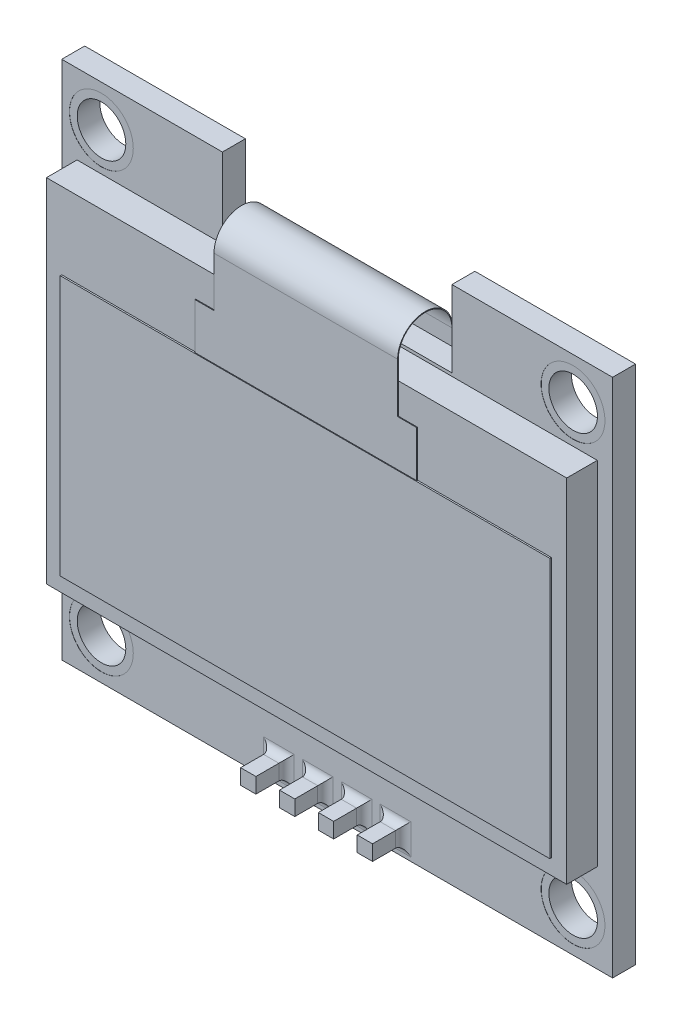
from build123d import *

# Parameters (mm, degrees)
CROQUIS1_W                   = 36
CROQUIS1_H                   = 34
SALIENTE_EXTRUIR1_DEPTH      = 1.5
CROQUIS2_W                   = 15
CROQUIS2_H                   = 5
CORTAR_EXTRUIR1_DEPTH        = 1.5
CROQUIS3_R                   = 1.5875
CORTAR_EXTRUIR2_DEPTH        = 2.54
CROQUIS4_W                   = 34
CROQUIS4_H                   = 23
SALIENTE_EXTRUIR2_DEPTH      = 2
SALIENTE_EXTRUIR3_DEPTH      = 0.05
CROQUIS5_W                   = 32
CROQUIS5_H                   = 17
SALIENTE_EXTRUIR5_DEPTH      = 0.1
SALIENTE_EXTRUIR6_DEPTH      = 0.05
CROQUIS12_W                  = 12
CROQUIS12_H                  = 0.05
SALIENTE_EXTRUIR7_DEPTH      = 2
SALIENTE_EXTRUIR7_DEPTH_BACK = 10
CROQUIS15_W                  = 1
CROQUIS15_H                  = 1
CROQUIS16_W                  = 2
CROQUIS16_H                  = 2
SALIENTE_EXTRUIR8_DEPTH      = 2
CROQUIS17_W                  = 9.62
CROQUIS17_H                  = 1.5
SALIENTE_EXTRUIR9_DEPTH      = 2
REDONDEO1_R                  = 0.5
CROQUIS18_W                  = 0.1
CROQUIS18_H                  = 2
SALIENTE_EXTRUIR10_DEPTH     = 0.1
CROQUIS19_W                  = 0.8
CROQUIS19_H                  = 2
SALIENTE_EXTRUIR11_DEPTH     = 1
MATRIZL1_COUNT               = 11
MATRIZL1_PITCH               = 2.8
CROQUIS22_W                  = 2
CROQUIS22_H                  = 0.8
CROQUIS22_W_2                = 1.5
CROQUIS22_H_2                = 3
SALIENTE_EXTRUIR12_DEPTH     = 1
CROQUIS40_W                  = 0.949222494
CROQUIS40_H                  = 0.489139996
CROQUIS40_W_2                = 1.06366802
CROQUIS40_H_2                = 0.489139997
SALIENTE_EXTRUIR13_DEPTH     = 0.5
REDONDEO3_R                  = 1
CROQUIS41_R                  = 2.0875
CORTAR_EXTRUIR4_DEPTH        = 0.01
CORTAR_EXTRUIR5_START        = -0.01
CROQUIS42_R                  = 2.0875
CORTAR_EXTRUIR5_DEPTH        = 0.01


with BuildPart() as part:
    # Croquis1 → Saliente-Extruir1 (new body)
    with BuildSketch(Plane.XY):
        Rectangle(CROQUIS1_W, CROQUIS1_H)
    extrude(amount=SALIENTE_EXTRUIR1_DEPTH)

    # Croquis2 → Cortar-Extruir1 (cut)
    with BuildSketch(Plane.XY.offset(1.5)):
        with Locations((0, 14.5)):
            Rectangle(CROQUIS2_W, CROQUIS2_H)
    extrude(amount=-CORTAR_EXTRUIR1_DEPTH, mode=Mode.SUBTRACT)

    # Croquis3 → Cortar-Extruir2 (cut)
    with BuildSketch(Plane.XY.offset(1.5)):
        with Locations((-15.4125, 14.2875)):
            Circle(CROQUIS3_R)
        with Locations((15.4125, 14.2875)):
            Circle(CROQUIS3_R)
        with Locations((15.4125, -14.2875)):
            Circle(CROQUIS3_R)
        with Locations((-15.4125, -14.2875)):
            Circle(CROQUIS3_R)
    extrude(amount=-CORTAR_EXTRUIR2_DEPTH, mode=Mode.SUBTRACT)

    # Croquis4 → Saliente-Extruir2 (add)
    with BuildSketch(Plane.XY.offset(1.5)):
        with Locations((0, 0.3)):
            Rectangle(CROQUIS4_W, CROQUIS4_H)
    extrude(amount=SALIENTE_EXTRUIR2_DEPTH)

    # Croquis7 → Saliente-Extruir3 (add)
    with BuildSketch(Plane(origin=(0, 0, 0), x_dir=(-1, 0, 0), z_dir=(0, 0, -1))):
        Polygon((-11, 6), (11, 6), (11, 9), (6, 12.5), (6, 13), (-6, 13), (-6, 12.5), (-11, 9), align=None)
    extrude(amount=SALIENTE_EXTRUIR3_DEPTH)

    # Croquis5 → Saliente-Extruir5 (add)
    with BuildSketch(Plane.XY.offset(3.5)):
        with Locations((0, -1.7)):
            Rectangle(CROQUIS5_W, CROQUIS5_H)
    extrude(amount=SALIENTE_EXTRUIR5_DEPTH)

    # Croquis14 → Saliente-Extruir6 (add)
    with BuildSketch(Plane.XY.offset(3.5)):
        Polygon((-6, 11.8), (6, 11.8), (6, 9.8), (7.248091461, 9.8), (7.248091461, 3.8), (-7.248091461, 3.8), (-7.248091461, 9.8), (-6, 9.8), align=None)
    extrude(amount=SALIENTE_EXTRUIR6_DEPTH)

    # Barrer3: sweep along a path in Croquis8
    with BuildLine(Plane(origin=(0, 0, 0), x_dir=(0, 0, -1), z_dir=(1, 0, 0))) as barrer3_path:
        Line((0.025, 13), (0.025, 13.047852621))
        ThreePointArc((0.025, 13.047852621), (-1.75, 14.822852621), (-3.525, 13.047852621))
        Line((-3.525, 13.047852621), (-3.525, 11.8))
    # Croquis12 → Barrer3 (sweep)
    with BuildSketch(Plane(origin=(0, 13, 0), x_dir=(1, 0, 0), z_dir=(0, 1, 0))):
        with Locations((0, 0.025)):
            Rectangle(CROQUIS12_W, CROQUIS12_H)
    sweep(path=barrer3_path.line)

    # Croquis15 → Saliente-Extruir7 (add, two sides: drawn at the far end of the back side and taken through both)
    with BuildSketch(Plane.XY.offset(1.5).offset(-SALIENTE_EXTRUIR7_DEPTH_BACK)):
        with Locations((1.27, -15.75)):
            Rectangle(CROQUIS15_W, CROQUIS15_H)
        with Locations((3.81, -15.75)):
            Rectangle(CROQUIS15_W, CROQUIS15_H)
        with Locations((-1.27, -15.75)):
            Rectangle(CROQUIS15_W, CROQUIS15_H)
        with Locations((-3.81, -15.75)):
            Rectangle(CROQUIS15_W, CROQUIS15_H)
    extrude(amount=SALIENTE_EXTRUIR7_DEPTH + SALIENTE_EXTRUIR7_DEPTH_BACK)

    # Croquis16 → Saliente-Extruir8 (add)
    with BuildSketch(Plane(origin=(0, 0, 0), x_dir=(-1, 0, 0), z_dir=(0, 0, -1))):
        with Locations((3.81, -15.75)):
            Rectangle(CROQUIS16_W, CROQUIS16_H)
        with Locations((1.27, -15.75)):
            Rectangle(CROQUIS16_W, CROQUIS16_H)
        with Locations((-1.27, -15.75)):
            Rectangle(CROQUIS16_W, CROQUIS16_H)
        with Locations((-3.81, -15.75)):
            Rectangle(CROQUIS16_W, CROQUIS16_H)
    extrude(amount=SALIENTE_EXTRUIR8_DEPTH)

    # Croquis17 → Saliente-Extruir9 (add)
    with BuildSketch(Plane(origin=(0, 0, 0), x_dir=(-1, 0, 0), z_dir=(0, 0, -1))):
        with Locations((0, -15.75)):
            Rectangle(CROQUIS17_W, CROQUIS17_H)
    extrude(amount=SALIENTE_EXTRUIR9_DEPTH)

    # Redondeo1
    redondeo1_edges = [part.edges().sort_by_distance(p)[0] for p in [
        (3.81, -16.25, 1.5),
        (4.31, -15.75, 1.5),
        (3.81, -15.25, 1.5),
        (3.31, -15.75, 1.5),
        (1.27, -16.25, 1.5),
        (1.77, -15.75, 1.5),
        (1.27, -15.25, 1.5),
        (0.77, -15.75, 1.5),
        (-1.27, -16.25, 1.5),
        (-0.77, -15.75, 1.5),
        (-1.27, -15.25, 1.5),
        (-1.77, -15.75, 1.5),
        (-3.81, -16.25, 1.5),
        (-3.31, -15.75, 1.5),
        (-3.81, -15.25, 1.5),
        (-4.31, -15.75, 1.5),
    ]]
    fillet(redondeo1_edges, radius=REDONDEO1_R)

    # Croquis18 → Saliente-Extruir10 (add)
    with BuildSketch(Plane(origin=(0, 0, 0), x_dir=(-1, 0, 0), z_dir=(0, 0, -1))):
        with Locations((-10.677251375, 5.762476183)):
            Rectangle(CROQUIS18_W, CROQUIS18_H)
        with Locations((-10.377251375, 5.762476183)):
            Rectangle(CROQUIS18_W, CROQUIS18_H)
        with Locations((-10.077251375, 5.762476183)):
            Rectangle(CROQUIS18_W, CROQUIS18_H)
        with Locations((-9.777251375, 5.762476183)):
            Rectangle(CROQUIS18_W, CROQUIS18_H)
        with Locations((-9.477251375, 5.762476183)):
            Rectangle(CROQUIS18_W, CROQUIS18_H)
        with Locations((-9.177251375, 5.762476183)):
            Rectangle(CROQUIS18_W, CROQUIS18_H)
        with Locations((-8.877251375, 5.762476183)):
            Rectangle(CROQUIS18_W, CROQUIS18_H)
        with Locations((-8.577251375, 5.762476183)):
            Rectangle(CROQUIS18_W, CROQUIS18_H)
        with Locations((-8.277251375, 5.762476183)):
            Rectangle(CROQUIS18_W, CROQUIS18_H)
        with Locations((-7.977251375, 5.762476183)):
            Rectangle(CROQUIS18_W, CROQUIS18_H)
        with Locations((-7.677251375, 5.762476183)):
            Rectangle(CROQUIS18_W, CROQUIS18_H)
        with Locations((-7.377251375, 5.762476183)):
            Rectangle(CROQUIS18_W, CROQUIS18_H)
        with Locations((-7.077251375, 5.762476183)):
            Rectangle(CROQUIS18_W, CROQUIS18_H)
        with Locations((-6.777251375, 5.762476183)):
            Rectangle(CROQUIS18_W, CROQUIS18_H)
        with Locations((-6.477251375, 5.762476183)):
            Rectangle(CROQUIS18_W, CROQUIS18_H)
        with Locations((-6.177251375, 5.762476183)):
            Rectangle(CROQUIS18_W, CROQUIS18_H)
        with Locations((-5.877251375, 5.762476183)):
            Rectangle(CROQUIS18_W, CROQUIS18_H)
        with Locations((-5.577251375, 5.762476183)):
            Rectangle(CROQUIS18_W, CROQUIS18_H)
        with Locations((-5.277251375, 5.762476183)):
            Rectangle(CROQUIS18_W, CROQUIS18_H)
        with Locations((-4.977251375, 5.762476183)):
            Rectangle(CROQUIS18_W, CROQUIS18_H)
        with Locations((-4.677251375, 5.762476183)):
            Rectangle(CROQUIS18_W, CROQUIS18_H)
        with Locations((-4.377251375, 5.762476183)):
            Rectangle(CROQUIS18_W, CROQUIS18_H)
        with Locations((-4.077251375, 5.762476183)):
            Rectangle(CROQUIS18_W, CROQUIS18_H)
        with Locations((-3.777251375, 5.762476183)):
            Rectangle(CROQUIS18_W, CROQUIS18_H)
        with Locations((-3.477251375, 5.762476183)):
            Rectangle(CROQUIS18_W, CROQUIS18_H)
        with Locations((-3.177251375, 5.762476183)):
            Rectangle(CROQUIS18_W, CROQUIS18_H)
        with Locations((-2.877251375, 5.762476183)):
            Rectangle(CROQUIS18_W, CROQUIS18_H)
        with Locations((-2.577251375, 5.762476183)):
            Rectangle(CROQUIS18_W, CROQUIS18_H)
        with Locations((-2.277251375, 5.762476183)):
            Rectangle(CROQUIS18_W, CROQUIS18_H)
        with Locations((-1.977251375, 5.762476183)):
            Rectangle(CROQUIS18_W, CROQUIS18_H)
        with Locations((-1.677251375, 5.762476183)):
            Rectangle(CROQUIS18_W, CROQUIS18_H)
        with Locations((-1.377251375, 5.762476183)):
            Rectangle(CROQUIS18_W, CROQUIS18_H)
        with Locations((-1.077251375, 5.762476183)):
            Rectangle(CROQUIS18_W, CROQUIS18_H)
        with Locations((-0.777251375, 5.762476183)):
            Rectangle(CROQUIS18_W, CROQUIS18_H)
        with Locations((-0.477251375, 5.762476183)):
            Rectangle(CROQUIS18_W, CROQUIS18_H)
        with Locations((-0.177251375, 5.762476183)):
            Rectangle(CROQUIS18_W, CROQUIS18_H)
        with Locations((0.122748625, 5.762476183)):
            Rectangle(CROQUIS18_W, CROQUIS18_H)
        with Locations((0.422748625, 5.762476183)):
            Rectangle(CROQUIS18_W, CROQUIS18_H)
        with Locations((0.722748625, 5.762476183)):
            Rectangle(CROQUIS18_W, CROQUIS18_H)
        with Locations((1.022748625, 5.762476183)):
            Rectangle(CROQUIS18_W, CROQUIS18_H)
        with Locations((1.322748625, 5.762476183)):
            Rectangle(CROQUIS18_W, CROQUIS18_H)
        with Locations((1.622748625, 5.762476183)):
            Rectangle(CROQUIS18_W, CROQUIS18_H)
        with Locations((1.922748625, 5.762476183)):
            Rectangle(CROQUIS18_W, CROQUIS18_H)
        with Locations((2.222748625, 5.762476183)):
            Rectangle(CROQUIS18_W, CROQUIS18_H)
        with Locations((2.522748625, 5.762476183)):
            Rectangle(CROQUIS18_W, CROQUIS18_H)
        with Locations((2.822748625, 5.762476183)):
            Rectangle(CROQUIS18_W, CROQUIS18_H)
        with Locations((3.122748625, 5.762476183)):
            Rectangle(CROQUIS18_W, CROQUIS18_H)
        with Locations((3.422748625, 5.762476183)):
            Rectangle(CROQUIS18_W, CROQUIS18_H)
        with Locations((3.722748625, 5.762476183)):
            Rectangle(CROQUIS18_W, CROQUIS18_H)
        with Locations((4.022748625, 5.762476183)):
            Rectangle(CROQUIS18_W, CROQUIS18_H)
        with Locations((4.322748625, 5.762476183)):
            Rectangle(CROQUIS18_W, CROQUIS18_H)
        with Locations((4.622748625, 5.762476183)):
            Rectangle(CROQUIS18_W, CROQUIS18_H)
        with Locations((4.922748625, 5.762476183)):
            Rectangle(CROQUIS18_W, CROQUIS18_H)
        with Locations((5.222748625, 5.762476183)):
            Rectangle(CROQUIS18_W, CROQUIS18_H)
        with Locations((5.522748625, 5.762476183)):
            Rectangle(CROQUIS18_W, CROQUIS18_H)
        with Locations((5.822748625, 5.762476183)):
            Rectangle(CROQUIS18_W, CROQUIS18_H)
        with Locations((6.122748625, 5.762476183)):
            Rectangle(CROQUIS18_W, CROQUIS18_H)
        with Locations((6.422748625, 5.762476183)):
            Rectangle(CROQUIS18_W, CROQUIS18_H)
        with Locations((6.722748625, 5.762476183)):
            Rectangle(CROQUIS18_W, CROQUIS18_H)
        with Locations((7.022748625, 5.762476183)):
            Rectangle(CROQUIS18_W, CROQUIS18_H)
        with Locations((7.322748625, 5.762476183)):
            Rectangle(CROQUIS18_W, CROQUIS18_H)
        with Locations((7.622748625, 5.762476183)):
            Rectangle(CROQUIS18_W, CROQUIS18_H)
        with Locations((7.922748625, 5.762476183)):
            Rectangle(CROQUIS18_W, CROQUIS18_H)
        with Locations((8.222748625, 5.762476183)):
            Rectangle(CROQUIS18_W, CROQUIS18_H)
        with Locations((8.522748625, 5.762476183)):
            Rectangle(CROQUIS18_W, CROQUIS18_H)
        with Locations((8.822748625, 5.762476183)):
            Rectangle(CROQUIS18_W, CROQUIS18_H)
        with Locations((9.122748625, 5.762476183)):
            Rectangle(CROQUIS18_W, CROQUIS18_H)
        with Locations((9.422748625, 5.762476183)):
            Rectangle(CROQUIS18_W, CROQUIS18_H)
        with Locations((9.722748625, 5.762476183)):
            Rectangle(CROQUIS18_W, CROQUIS18_H)
        with Locations((10.022748625, 5.762476183)):
            Rectangle(CROQUIS18_W, CROQUIS18_H)
        with Locations((10.322748625, 5.762476183)):
            Rectangle(CROQUIS18_W, CROQUIS18_H)
        with Locations((10.622748625, 5.762476183)):
            Rectangle(CROQUIS18_W, CROQUIS18_H)
    extrude(amount=SALIENTE_EXTRUIR10_DEPTH)

    # Croquis19 → Saliente-Extruir11 (add)
    with BuildSketch(Plane(origin=(0, 0, 0), x_dir=(-1, 0, 0), z_dir=(0, 0, -1))):
        with Locations((-12.6, 0)):
            Rectangle(CROQUIS19_W, CROQUIS19_H)
    saliente_extruir11 = extrude(amount=SALIENTE_EXTRUIR11_DEPTH)

    # Croquis20 → Revolución1 (revolve)
    with BuildSketch(Plane.XZ.offset(1)):
        with BuildLine():
            Line((12.6, -0.359578875), (12.6, 0.359578875))
            ThreePointArc((12.6, 0.359578875), (12.240421125, 0), (12.6, -0.359578875))
        make_face()
    revoluci_n1 = revolve(axis=Axis((12.6, -1, -0.359578875), (0, 0, 1)))

    # Croquis21 → Revolución2 (revolve)
    with BuildSketch(Plane(origin=(0, 1, 0), x_dir=(1, 0, 0), z_dir=(0, 1, 0))):
        with BuildLine():
            Line((12.6, 0.367959973), (12.6, -0.367959973))
            ThreePointArc((12.6, -0.367959973), (12.967959973, 0), (12.6, 0.367959973))
        make_face()
    revoluci_n2 = revolve(axis=Axis((12.6, 1, -0.367959973), (0, 0, 1)))

    # MatrizL1: Saliente-Extruir11, Revolución1, Revolución2 ×11
    with Locations(*[(-i * MATRIZL1_PITCH, 0, 0) for i in range(1, MATRIZL1_COUNT)]):
        add(saliente_extruir11)
        add(revoluci_n1)
        add(revoluci_n2)

    # Croquis22 → Saliente-Extruir12 (add)
    with BuildSketch(Plane(origin=(0, 0, 0), x_dir=(-1, 0, 0), z_dir=(0, 0, -1))):
        with Locations((-7, -5.686157652)):
            Rectangle(CROQUIS22_W, CROQUIS22_H)
        with Locations((-7, -7.986157652)):
            Rectangle(CROQUIS22_W, CROQUIS22_H)
        with Locations((-12.6, -6.836157652)):
            Rectangle(CROQUIS22_W_2, CROQUIS22_H_2)
        with Locations((7, -7.986157652)):
            Rectangle(CROQUIS22_W, CROQUIS22_H)
        with Locations((7, -5.686157652)):
            Rectangle(CROQUIS22_W, CROQUIS22_H)
        with Locations((-13.360034797, -10.01424112)):
            Rectangle(CROQUIS22_W, CROQUIS22_H)
        with Locations((-1.25247771, -12.9424589)):
            Rectangle(CROQUIS22_W, CROQUIS22_H)
        with Locations((1.25247771, -11.666949526)):
            Rectangle(CROQUIS22_W, CROQUIS22_H)
    extrude(amount=SALIENTE_EXTRUIR12_DEPTH)

    # Croquis26 → Revolución4 (revolve)
    with BuildSketch(Plane.ZY.offset(8)):
        with BuildLine():
            Line((0.371566211, -7.986157652), (-0.371566211, -7.986157652))
            ThreePointArc((-0.371566211, -7.986157652), (0, -7.614591441), (0.371566211, -7.986157652))
        make_face()
    revolve(axis=Axis((-8, -7.986157652, 0.371566211), (0, 0, -1)))

    # Croquis27 → Revolución5 (revolve)
    with BuildSketch(Plane.ZY.offset(8)):
        with BuildLine():
            Line((-0.362080918, -5.686157652), (0.362080918, -5.686157652))
            ThreePointArc((0.362080918, -5.686157652), (0, -5.324076734), (-0.362080918, -5.686157652))
        make_face()
    revolve(axis=Axis((-8, -5.686157652, -0.362080918), (0, 0, 1)))

    # Croquis28 → Revolución6 (revolve)
    with BuildSketch(Plane(origin=(-6, 0, 0), x_dir=(0, 0, -1), z_dir=(1, 0, 0))):
        with BuildLine():
            Line((0.361147888, -5.686157652), (-0.361147888, -5.686157652))
            ThreePointArc((-0.361147888, -5.686157652), (0, -6.04730554), (0.361147888, -5.686157652))
        make_face()
    revolve(axis=Axis((-6, -5.686157652, -0.361147888), (0, 0, 1)))

    # Croquis29 → Revolución7 (revolve)
    with BuildSketch(Plane(origin=(-6, 0, 0), x_dir=(0, 0, -1), z_dir=(1, 0, 0))):
        with BuildLine():
            Line((0.358539057, -7.986157652), (-0.358539057, -7.986157652))
            ThreePointArc((-0.358539057, -7.986157652), (0, -8.344696709), (0.358539057, -7.986157652))
        make_face()
    revolve(axis=Axis((-6, -7.986157652, -0.358539057), (0, 0, 1)))

    # Croquis30 → Revolución8 (revolve)
    with BuildSketch(Plane(origin=(8, 0, 0), x_dir=(0, 0, -1), z_dir=(1, 0, 0))):
        with BuildLine():
            Line((0.347340626, -5.686157652), (-0.347340626, -5.686157652))
            ThreePointArc((-0.347340626, -5.686157652), (0, -6.033498278), (0.347340626, -5.686157652))
        make_face()
    revolve(axis=Axis((8, -5.686157652, -0.347340626), (0, 0, 1)))

    # Croquis31 → Revolución9 (revolve)
    with BuildSketch(Plane(origin=(8, 0, 0), x_dir=(0, 0, -1), z_dir=(1, 0, 0))):
        with BuildLine():
            Line((0.349039637, -7.986157652), (-0.349039637, -7.986157652))
            ThreePointArc((-0.349039637, -7.986157652), (0, -8.335197289), (0.349039637, -7.986157652))
        make_face()
    revolve(axis=Axis((8, -7.986157652, -0.349039637), (0, 0, 1)))

    # Croquis32 → Revolución10 (revolve)
    with BuildSketch(Plane.ZY.offset(-6)):
        with BuildLine():
            Line((0.330676326, -7.986157652), (-0.330676326, -7.986157652))
            ThreePointArc((-0.330676326, -7.986157652), (0, -7.655481326), (0.330676326, -7.986157652))
        make_face()
    revolve(axis=Axis((6, -7.986157652, 0.330676326), (0, 0, -1)))

    # Croquis33 → Revolución11 (revolve)
    with BuildSketch(Plane.ZY.offset(-6)):
        with BuildLine():
            Line((0.332465018, -5.686157652), (-0.332465018, -5.686157652))
            ThreePointArc((-0.332465018, -5.686157652), (0, -5.353692634), (0.332465018, -5.686157652))
        make_face()
    revolve(axis=Axis((6, -5.686157652, 0.332465018), (0, 0, -1)))

    # Croquis34 → Revolución12 (revolve)
    with BuildSketch(Plane.ZY.offset(-12.360034797)):
        with BuildLine():
            Line((0.335465257, -10.01424112), (-0.335465257, -10.01424112))
            ThreePointArc((-0.335465257, -10.01424112), (0, -9.678775864), (0.335465257, -10.01424112))
        make_face()
    revolve(axis=Axis((12.360034797, -10.01424112, 0.335465257), (0, 0, -1)))

    # Croquis35 → Revolución13 (revolve)
    with BuildSketch(Plane(origin=(14.360034797, 0, 0), x_dir=(0, 0, -1), z_dir=(1, 0, 0))):
        with BuildLine():
            Line((0.348274901, -10.01424112), (-0.348274901, -10.01424112))
            ThreePointArc((-0.348274901, -10.01424112), (0, -10.362516021), (0.348274901, -10.01424112))
        make_face()
    revolve(axis=Axis((14.360034797, -10.01424112, -0.348274901), (0, 0, 1)))

    # Croquis36 → Revolución14 (revolve)
    with BuildSketch(Plane(origin=(2.25247771, 0, 0), x_dir=(0, 0, -1), z_dir=(1, 0, 0))):
        with BuildLine():
            Line((-0.337831795, -12.9424589), (0.337831795, -12.9424589))
            ThreePointArc((0.337831795, -12.9424589), (0, -13.280290695), (-0.337831795, -12.9424589))
        make_face()
    revolve(axis=Axis((2.25247771, -12.9424589, 0.337831795), (0, 0, -1)))

    # Croquis37 → Revolución15 (revolve)
    with BuildSketch(Plane(origin=(-0.25247771, 0, 0), x_dir=(0, 0, -1), z_dir=(1, 0, 0))):
        with BuildLine():
            Line((-0.349620403, -11.666949526), (0.349620403, -11.666949526))
            ThreePointArc((0.349620403, -11.666949526), (0, -12.016569929), (-0.349620403, -11.666949526))
        make_face()
    revolve(axis=Axis((-0.25247771, -11.666949526, 0.349620403), (0, 0, -1)))

    # Croquis38 → Revolución16 (revolve)
    with BuildSketch(Plane.ZY.offset(2.25247771)):
        with BuildLine():
            Line((0.320724776, -11.666949526), (-0.320724776, -11.666949526))
            ThreePointArc((-0.320724776, -11.666949526), (0, -11.34622475), (0.320724776, -11.666949526))
        make_face()
    revolve(axis=Axis((-2.25247771, -11.666949526, 0.320724776), (0, 0, -1)))

    # Croquis39 → Revolución17 (revolve)
    with BuildSketch(Plane.ZY.offset(-0.25247771)):
        with BuildLine():
            Line((0.33508155, -12.9424589), (-0.33508155, -12.9424589))
            ThreePointArc((-0.33508155, -12.9424589), (0, -12.60737735), (0.33508155, -12.9424589))
        make_face()
    revolve(axis=Axis((0.25247771, -12.9424589, 0.33508155), (0, 0, -1)))

    # Croquis40 → Saliente-Extruir13 (add)
    with BuildSketch(Plane(origin=(0, 0, 0), x_dir=(-1, 0, 0), z_dir=(0, 0, -1))):
        with Locations((-13.824611247, -6.836157652)):
            Rectangle(CROQUIS40_W, CROQUIS40_H)
        with Locations((-11.31816599, -5.94953509)):
            Rectangle(CROQUIS40_W_2, CROQUIS40_H_2)
        with Locations((-11.31816599, -7.845925488)):
            Rectangle(CROQUIS40_W_2, CROQUIS40_H_2)
    extrude(amount=SALIENTE_EXTRUIR13_DEPTH)

    # Redondeo3
    # the kernel refuses this fillet: 1 mm, written as the material it takes off along each edge
    with BuildSketch(Plane(origin=(14.299222494, -4.426524144, -0.5), x_dir=(0, 0, 1), z_dir=(0, -1, 0))) as redondeo3_piece_1:
        with BuildLine():
            CenterArc((1, 0.866025404), REDONDEO3_R, 180, 60)
            Line((0, 0.866025404), (-0.02, 0.866025404))
            Line((-0.02, 0.866025404), (-0.02, 0))
            Line((-0.02, 0), (0, -0.02))
            ThreePointArc((0, -0.02), (0.25, -0.02), (0.49, -0.017320508))
            Line((0.49, -0.017320508), (0.5, 0))
        make_face()
    extrude(amount=4.819267016, mode=Mode.SUBTRACT)
    with BuildSketch(Plane(origin=(10.78633198, -3.539901582, -0.5), x_dir=(0, 0, 1), z_dir=(0, -1, 0)), Plane(origin=(10.78633198, -5.43629198, -0.5), x_dir=(0, 0, 1), z_dir=(0, -1, 0))) as redondeo3_piece_2:
        with BuildLine():
            CenterArc((1, -0.866025404), REDONDEO3_R, 120, 60)
            Line((0, -0.866025404), (-0.02, -0.866025404))
            Line((-0.02, -0.866025404), (-0.02, 0))
            Line((-0.02, 0), (0, 0.02))
            ThreePointArc((0, 0.02), (0.25, 0.02), (0.49, 0.017320508))
            Line((0.49, 0.017320508), (0.5, 0))
        make_face()
    extrude(amount=4.819267016, mode=Mode.SUBTRACT)

    # Croquis41 → Cortar-Extruir4 (cut)
    with BuildSketch(Plane.XY.offset(1.5)):
        with Locations((-15.4125, 14.2875)):
            Circle(CROQUIS41_R)
        with Locations((15.4125, 14.2875)):
            Circle(CROQUIS41_R)
        with Locations((15.4125, -14.2875)):
            Circle(CROQUIS41_R)
        with Locations((-15.4125, -14.2875)):
            Circle(CROQUIS41_R)
    extrude(amount=-CORTAR_EXTRUIR4_DEPTH, mode=Mode.SUBTRACT)

    # Croquis42 → Cortar-Extruir5 (cut)
    with BuildSketch(Plane(origin=(0, 0, 0), x_dir=(-1, 0, 0), z_dir=(0, 0, -1)).offset(CORTAR_EXTRUIR5_START)):
        with Locations(Location((-15.4125, 14.2875, 0), (0, 0, 180))):
            Circle(CROQUIS42_R)
        with Locations(Location((15.4125, 14.2875, 0), (0, 0, 180))):
            Circle(CROQUIS42_R)
        with Locations(Location((15.4125, -14.2875, 0), (0, 0, 180))):
            Circle(CROQUIS42_R)
        with Locations(Location((-15.4125, -14.2875, 0), (0, 0, 180))):
            Circle(CROQUIS42_R)
    extrude(amount=CORTAR_EXTRUIR5_DEPTH, mode=Mode.SUBTRACT)


solid = part.part
